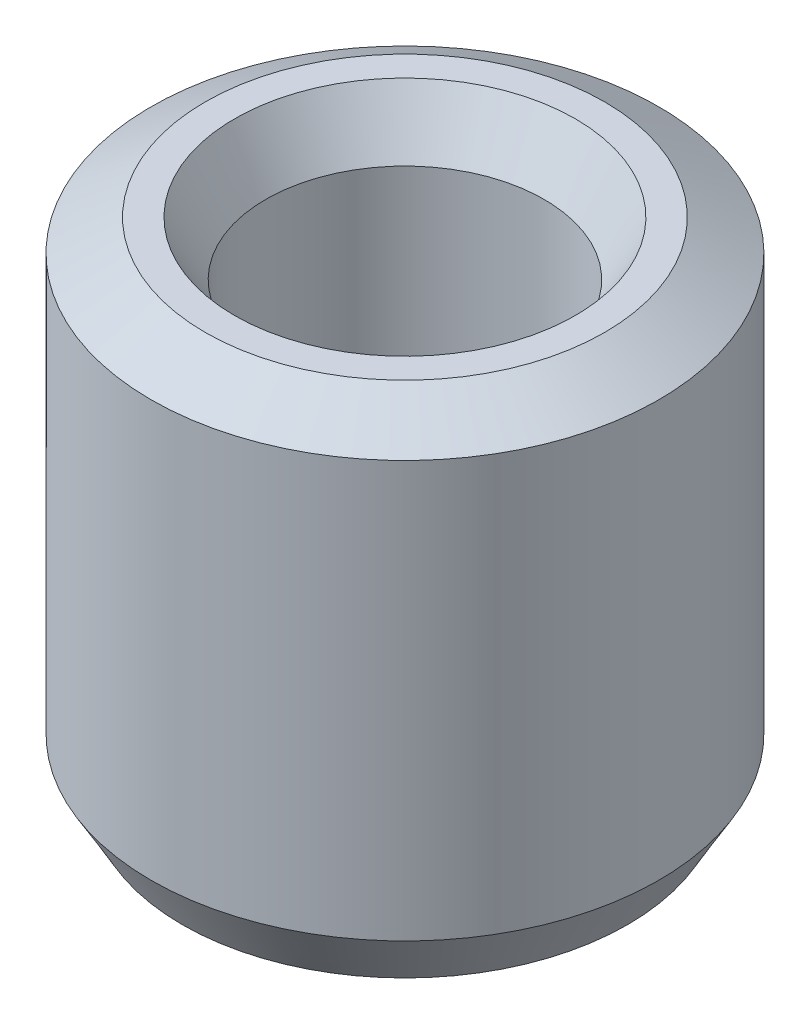
from build123d import *
from OCP.BRepFilletAPI import BRepFilletAPI_MakeChamfer

# Parameters (mm, degrees)
SKETCH1_R           = 12.5
BOSS_EXTRUDE1_DEPTH = 24.697053767
SKETCH2_R           = 6.852910879
CUT_EXTRUDE1_DEPTH  = 31.371770853
CHAMFER1_SIZE       = 1.538859793
CHAMFER1_SIZE2      = 2.665383347


with BuildPart() as part:
    # Sketch1 → Boss-Extrude1 (new body)
    with BuildSketch(Plane(origin=(0, 0, 0), x_dir=(1, 0, 0), z_dir=(0, 1, 0))):
        Circle(SKETCH1_R)
    extrude(amount=BOSS_EXTRUDE1_DEPTH)

    # Sketch2 → Cut-Extrude1 (cut, through all)
    with BuildSketch(Plane(origin=(0, 0, 0), x_dir=(1, 0, 0), z_dir=(0, 1, 0))):
        Circle(SKETCH2_R)
    extrude(amount=CUT_EXTRUDE1_DEPTH, mode=Mode.SUBTRACT)

    # Chamfer1: one chamfer whose edges measure the first distance from different faces: ONE call of the kernel's chamfer builder (chamfer() names one face for all edges)
    chamfer1_edges_1 = [part.edges().sort_by_distance(p)[0] for p in [
        (-6.852910879, 24.697053767, 0),
    ]]
    chamfer1_side_1 = [part.faces().sort_by_distance(p)[0] for p in [
        (-12.146446609, 24.697053767, 0),
    ]]
    chamfer1_edges_2 = [part.edges().sort_by_distance(p)[0] for p in [
        (-6.852910879, 0, 0),
    ]]
    chamfer1_side_2 = [part.faces().sort_by_distance(p)[0] for p in [
        (-6.852910879, 12.348526884, 0),
    ]]
    chamfer1_edges_3 = [part.edges().sort_by_distance(p)[0] for p in [
        (-12.5, 0, 0),
    ]]
    chamfer1_side_3 = [part.faces().sort_by_distance(p)[0] for p in [
        (-12.146446609, 0, 0),
    ]]
    chamfer1_edges_4 = [part.edges().sort_by_distance(p)[0] for p in [
        (-12.5, 24.697053767, 0),
    ]]
    chamfer1_side_4 = [part.faces().sort_by_distance(p)[0] for p in [
        (-12.5, 12.348526884, 0),
    ]]
    chamfer1 = BRepFilletAPI_MakeChamfer(part.part.solid().wrapped)
    for e in chamfer1_edges_1:
        chamfer1.Add(CHAMFER1_SIZE, CHAMFER1_SIZE2, e.wrapped, chamfer1_side_1[0].wrapped)  # the first distance lies on this face
    for e in chamfer1_edges_2:
        chamfer1.Add(CHAMFER1_SIZE, CHAMFER1_SIZE2, e.wrapped, chamfer1_side_2[0].wrapped)  # the first distance lies on this face
    for e in chamfer1_edges_3:
        chamfer1.Add(CHAMFER1_SIZE, CHAMFER1_SIZE2, e.wrapped, chamfer1_side_3[0].wrapped)  # the first distance lies on this face
    for e in chamfer1_edges_4:
        chamfer1.Add(CHAMFER1_SIZE, CHAMFER1_SIZE2, e.wrapped, chamfer1_side_4[0].wrapped)  # the first distance lies on this face
    add(Compound.cast(chamfer1.Shape()), mode=Mode.REPLACE)


solid = part.part
